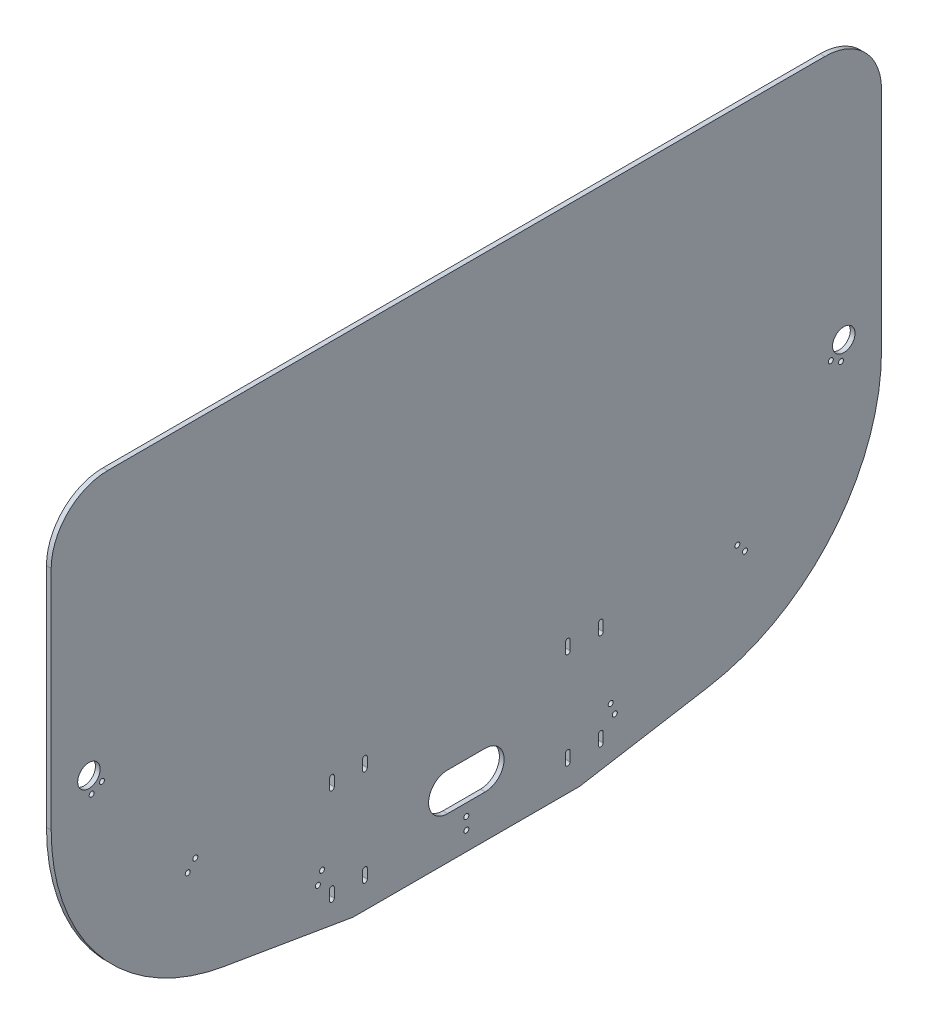
from build123d import *

# Parameters (mm, degrees)
SKETCH1_R                       = 15.113
BOSS_EXTRUDE1_DEPTH             = 6.35
FILLET1_R                       = 76.2
F_1_4_0_25_DIAMETER_SLOT1_DEPTH = 6.35
SKETCH4_R                       = 3.3655
CUT_EXTRUDE1_DEPTH              = 885.657788357
CIRPATTERN1_COUNT               = 4
CIRPATTERN1_ANGLE               = 60.5
CIRPATTERN1_THE_OTHER_WAY_COUNT = 4
CIRPATTERN1_THE_OTHER_WAY_ANGLE = 60.5
CUT_EXTRUDE2_DEPTH              = 885.657788357


# Read off the part's stored shape, not the designer's step: 1/4 (0.25) Diameter Slot1
with BuildPart() as part:
    # Sketch1 → Boss-Extrude1 (new body)
    with BuildSketch(Plane(origin=(0, 0, 0), x_dir=(0, 0, -1), z_dir=(1, 0, 0))):
        with BuildLine():
            Line((-558.8, 304.8), (-558.8, 685.8))
            Line((-558.8, 685.8), (558.8, 685.8))
            Line((558.8, 685.8), (558.8, 304.8))
            ThreePointArc((558.8, 304.8), (492.779998657, 124.430002015), (325.91999876, 29.300000517))
            Line((325.91999876, 29.300000517), (152.4, 0))
            Line((152.4, 0), (-152.4, 0))
            Line((-152.4, 0), (-325.91999876, 29.300000517))
            ThreePointArc((-325.91999876, 29.300000517), (-492.779998657, 124.430002015), (-558.8, 304.8))
        make_face()
        with Locations((-508, 342.9)):
            Circle(SKETCH1_R, mode=Mode.SUBTRACT)
        with Locations((508, 342.9)):
            Circle(SKETCH1_R, mode=Mode.SUBTRACT)
    extrude(amount=BOSS_EXTRUDE1_DEPTH)

    # Fillet1
    fillet1_edges = [part.edges().sort_by_distance(p)[0] for p in [
        (3.175, 685.8, 558.8),
        (3.175, 685.8, -558.8),
    ]]
    fillet(fillet1_edges, radius=FILLET1_R)

    # 1/4 (0.25) Diameter Slot1 outline → 1/4 (0.25) Diameter Slot1 (cut)
    with BuildSketch(Plane.YZ):
        with BuildLine():
            Line((47.625, -177.8), (34.925, -177.8))
            ThreePointArc((34.925, -177.8), (31.75, -180.975), (34.925, -184.15))
            Line((34.925, -184.15), (47.625, -184.15))
            ThreePointArc((47.625, -184.15), (50.8, -180.975), (47.625, -177.8))
        make_face()
        with BuildLine():
            ThreePointArc((164.719, -177.8), (161.544, -180.975), (164.719, -184.15))
            Line((164.719, -184.15), (177.419, -184.15))
            ThreePointArc((177.419, -184.15), (180.594, -180.975), (177.419, -177.8))
            Line((177.419, -177.8), (164.719, -177.8))
        make_face()
        with BuildLine():
            Line((47.625, -133.35), (34.925, -133.35))
            ThreePointArc((34.925, -133.35), (31.75, -136.525), (34.925, -139.7))
            Line((34.925, -139.7), (47.625, -139.7))
            ThreePointArc((47.625, -139.7), (50.8, -136.525), (47.625, -133.35))
        make_face()
        with BuildLine():
            ThreePointArc((164.719, -133.35), (161.544, -136.525), (164.719, -139.7))
            Line((164.719, -139.7), (177.419, -139.7))
            ThreePointArc((177.419, -139.7), (180.594, -136.525), (177.419, -133.35))
            Line((177.419, -133.35), (164.719, -133.35))
        make_face()
        with BuildLine():
            Line((177.419, 139.7), (164.719, 139.7))
            ThreePointArc((164.719, 139.7), (161.544, 136.525), (164.719, 133.35))
            Line((164.719, 133.35), (177.419, 133.35))
            ThreePointArc((177.419, 133.35), (180.594, 136.525), (177.419, 139.7))
        make_face()
        with BuildLine():
            ThreePointArc((34.925, 139.7), (31.75, 136.525), (34.925, 133.35))
            Line((34.925, 133.35), (47.625, 133.35))
            ThreePointArc((47.625, 133.35), (50.8, 136.525), (47.625, 139.7))
            Line((47.625, 139.7), (34.925, 139.7))
        make_face()
        with BuildLine():
            Line((47.625, 184.15), (34.925, 184.15))
            ThreePointArc((34.925, 184.15), (31.75, 180.975), (34.925, 177.8))
            Line((34.925, 177.8), (47.625, 177.8))
            ThreePointArc((47.625, 177.8), (50.8, 180.975), (47.625, 184.15))
        make_face()
        with BuildLine():
            ThreePointArc((164.719, 184.15), (161.544, 180.975), (164.719, 177.8))
            Line((164.719, 177.8), (177.419, 177.8))
            ThreePointArc((177.419, 177.8), (180.594, 180.975), (177.419, 184.15))
            Line((177.419, 184.15), (164.719, 184.15))
        make_face()
    extrude(amount=F_1_4_0_25_DIAMETER_SLOT1_DEPTH, mode=Mode.SUBTRACT)

    # Sketch4 → Cut-Extrude1 (cut, through all)
    with BuildSketch(Plane(origin=(6.35, 0, 0), x_dir=(0, 0, -1), z_dir=(1, 0, 0))):
        with Locations((0, 41.154707227)):
            Circle(SKETCH4_R)
        with Locations((0, 25.279707227)):
            Circle(SKETCH4_R)
    cut_extrude1 = extrude(amount=-CUT_EXTRUDE1_DEPTH, mode=Mode.SUBTRACT)

    # CirPattern1: Cut-Extrude1 ×4 about axis
    cirpattern1_axis = Axis((0, 604.717207227, 0), (-1, 0, 0))
    for i in range(1, CIRPATTERN1_COUNT):
        add(cut_extrude1.rotate(cirpattern1_axis, i * CIRPATTERN1_ANGLE / (CIRPATTERN1_COUNT - 1)), mode=Mode.SUBTRACT)

    # CirPattern1 the other way: Cut-Extrude1 ×4 about axis
    cirpattern1_the_other_way_axis = Axis((0, 604.717207227, 0), (1, 0, 0))
    for i in range(1, CIRPATTERN1_THE_OTHER_WAY_COUNT):
        add(cut_extrude1.rotate(cirpattern1_the_other_way_axis, i * CIRPATTERN1_THE_OTHER_WAY_ANGLE / (CIRPATTERN1_THE_OTHER_WAY_COUNT - 1)), mode=Mode.SUBTRACT)

    # Sketch6 → Cut-Extrude2 (cut, through all)
    with BuildSketch(Plane(origin=(6.35, 0, 0), x_dir=(0, 0, -1), z_dir=(1, 0, 0))):
        with BuildLine():
            Line((-25.4, 107.95), (25.4, 107.95))
            ThreePointArc((25.4, 107.95), (50.8, 82.55), (25.4, 57.15))
            Line((25.4, 57.15), (-25.4, 57.15))
            ThreePointArc((-25.4, 57.15), (-50.8, 82.55), (-25.4, 107.95))
        make_face()
    extrude(amount=-CUT_EXTRUDE2_DEPTH, mode=Mode.SUBTRACT)


solid = part.part
